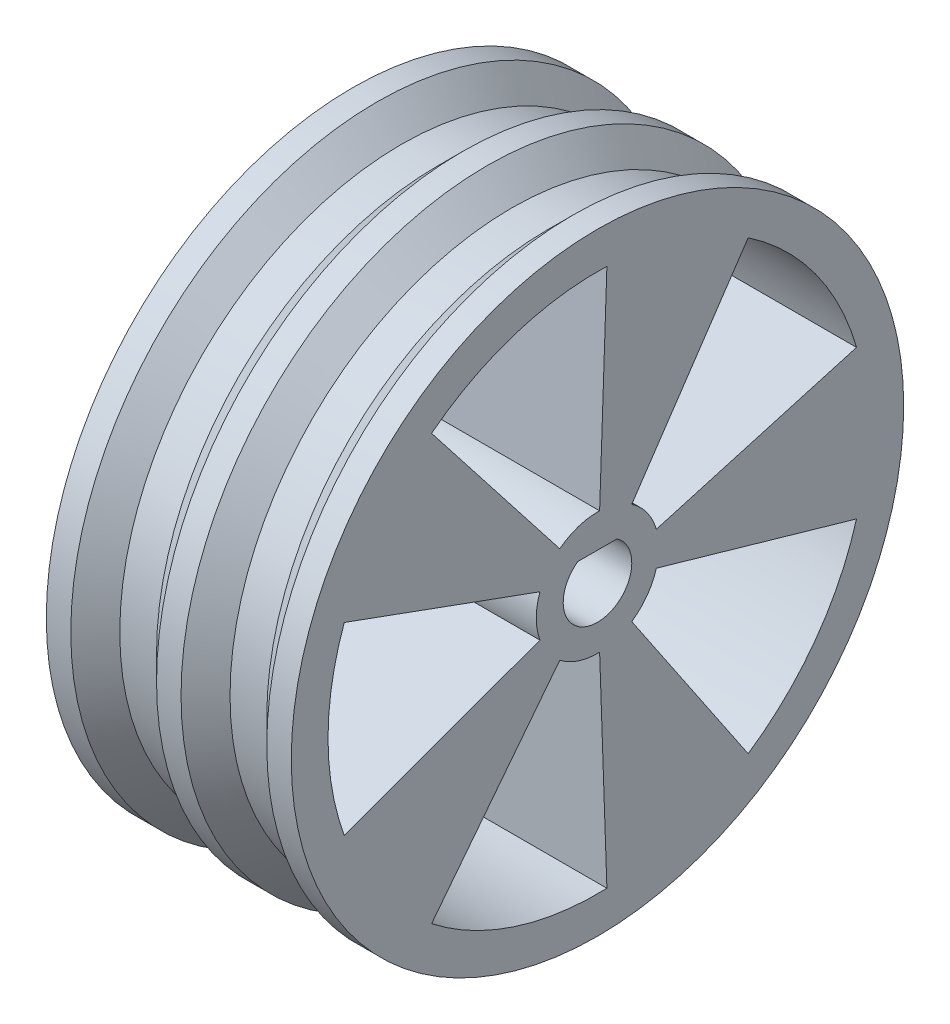
from build123d import *

# Parameters (mm, degrees)
BASE_DEPTH          = 10
BASE_DEPTH_BACK     = 10
ESQUISSE1_R         = 25
ESQUISSE2_R         = 25
ESQUISSE2_R_2       = 23
VIDE_GORGE_DEPTH    = 7
VIDE_JANTE_DEPTH    = 20
ESQUISSE6_R         = 3
VIDE_BLOC_AXE_DEPTH = 4
CHAN_SIZE           = 2


with BuildPart() as part:
    # Esquisse1 → BASE (new, two sides: drawn at the far end of the back side and taken through both)
    with BuildSketch(Plane(origin=(0, 0, 0), x_dir=(0, 0, -1), z_dir=(1, 0, 0)).offset(-BASE_DEPTH_BACK)):
        Circle(ESQUISSE1_R)
        with BuildLine():
            Line((-1.596871942, 2.3), (1.596871942, 2.3))
            ThreePointArc((1.596871942, 2.3), (0, -2.8), (-1.596871942, 2.3))
        make_face(mode=Mode.SUBTRACT)
    extrude(amount=BASE_DEPTH + BASE_DEPTH_BACK)

    # Esquisse2 → VIDE GORGE (cut)
    with BuildSketch(Plane.ZY.offset(8)):
        with Locations(Location((0, 0, 0), (0, 0, 180))):
            Circle(ESQUISSE2_R)
        Circle(ESQUISSE2_R_2, mode=Mode.SUBTRACT)
    vide_gorge = extrude(amount=-VIDE_GORGE_DEPTH, mode=Mode.SUBTRACT)

    # SYM GORGE: VIDE GORGE across plane
    add(vide_gorge.mirror(Plane(origin=(0, 0, 0), x_dir=(0, 0, 1), z_dir=(1, 0, 0))), mode=Mode.SUBTRACT)

    # Esquisse4 → VIDE JANTE (cut)
    with BuildSketch(Plane(origin=(10, 0, 0), x_dir=(0, 0, -1), z_dir=(1, 0, 0))):
        with BuildLine():
            Line((-22, 0), (-5, 0))
            ThreePointArc((-5, 0), (-4.924038765, 0.868240888), (-4.698463104, 1.710100717))
            Line((-4.698463104, 1.710100717), (-20.673237657, 7.524443153))
            ThreePointArc((-20.673237657, 7.524443153), (-21.665770566, 3.820259909), (-22, 0))
        make_face()
        with BuildLine():
            ThreePointArc((-4.698463104, -1.710100717), (-4.924038765, -0.868240888), (-5, 0))
            Line((-5, 0), (-22, 0))
            ThreePointArc((-22, 0), (-21.665770566, -3.820259909), (-20.673237657, -7.524443153))
            Line((-20.673237657, -7.524443153), (-4.698463104, -1.710100717))
        make_face()
        with BuildLine():
            Line((-13.544552457, 17.336236579), (-3.078307377, 3.940053768))
            ThreePointArc((-3.078307377, 3.940053768), (-1.545084972, 4.755282581), (0.174497484, 4.996954135))
            Line((0.174497484, 4.996954135), (0.767788927, 21.986598194))
            ThreePointArc((0.767788927, 21.986598194), (-6.798373876, 20.923243358), (-13.544552457, 17.336236579))
        make_face()
        with BuildLine():
            Line((12.302243876, 18.238826596), (2.795964517, 4.145187863))
            ThreePointArc((2.795964517, 4.145187863), (4.045084972, 2.938926261), (4.80630848, 1.378186779))
            Line((4.80630848, 1.378186779), (21.147757311, 6.064021828))
            ThreePointArc((21.147757311, 6.064021828), (17.798373876, 12.93127555), (12.302243876, 18.238826596))
        make_face()
        with BuildLine():
            ThreePointArc((4.80630848, -1.378186779), (4.045084972, -2.938926261), (2.795964517, -4.145187863))
            Line((2.795964517, -4.145187863), (12.302243876, -18.238826596))
            ThreePointArc((12.302243876, -18.238826596), (17.798373876, -12.93127555), (21.147757311, -6.064021828))
            Line((21.147757311, -6.064021828), (4.80630848, -1.378186779))
        make_face()
        with BuildLine():
            ThreePointArc((0.174497484, -4.996954135), (-1.545084972, -4.755282581), (-3.078307377, -3.940053768))
            Line((-3.078307377, -3.940053768), (-13.544552457, -17.336236579))
            ThreePointArc((-13.544552457, -17.336236579), (-6.798373876, -20.923243358), (0.767788927, -21.986598194))
            Line((0.767788927, -21.986598194), (0.174497484, -4.996954135))
        make_face()
    extrude(amount=-VIDE_JANTE_DEPTH, mode=Mode.SUBTRACT)

    # Esquisse6 → VIDE BLOC AXE (cut)
    with BuildSketch(Plane.ZY.offset(10)):
        Circle(ESQUISSE6_R)
    extrude(amount=-VIDE_BLOC_AXE_DEPTH, mode=Mode.SUBTRACT)

    # CHAN
    chan_edges = [part.edges().sort_by_distance(p)[0] for p in [
        (-1, 0, -23),
        (-8, 0, -23),
        (8, 0, -23),
        (1, 0, -23),
    ]]
    chamfer(chan_edges, length=CHAN_SIZE - 0.0001)  # a hair under: the kernel refuses the full size


solid = part.part
